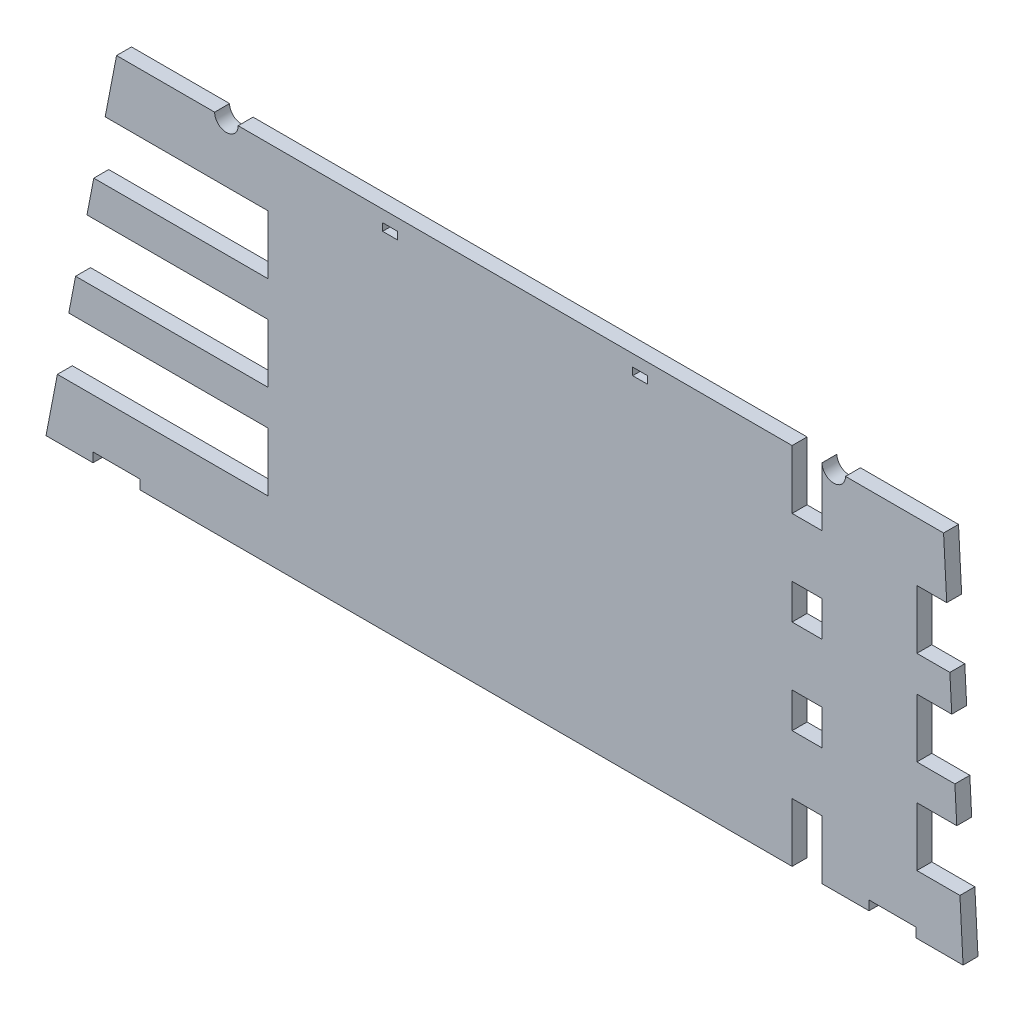
from build123d import *

# Parameters (mm, degrees)
SKETCH1_W      = 12.7
SKETCH1_H      = 15
SKETCH1_W_2    = 6.35
SKETCH1_H_2    = 3.175
EXTRUDE1_DEPTH = 6.35


with BuildPart() as part:
    # Sketch1 → Extrude1 (new body)
    with BuildSketch(Plane.XY):
        with BuildLine():
            Line((-159.50625, 4), (-159.50625, 0))
            Line((-159.50625, 0), (117.79375, 0))
            Line((117.79375, 0), (117.79375, 25))
            Line((117.79375, 25), (130.49375, 25))
            Line((130.49375, 25), (130.49375, 0))
            Line((130.49375, 0), (150.49375, 0))
            Line((150.49375, 0), (150.49375, 4))
            Line((150.49375, 4), (170.49375, 4))
            Line((170.49375, 4), (170.49375, 0))
            Line((170.49375, 0), (190.49375, 0))
            Line((190.49375, 0), (189.157056452, 25))
            Line((189.157056452, 25), (170.842943548, 25))
            Line((170.842943548, 25), (170.842943548, 50))
            Line((170.842943548, 50), (187.820362903, 50))
            Line((187.820362903, 50), (187.018346774, 65))
            Line((187.018346774, 65), (170.842943548, 65))
            Line((170.842943548, 65), (170.842943548, 90))
            Line((170.842943548, 90), (185.681653226, 90))
            Line((185.681653226, 90), (184.879637097, 105))
            Line((184.879637097, 105), (170.842943548, 105))
            Line((170.842943548, 105), (170.842943548, 130))
            Line((170.842943548, 130), (183.542943548, 130))
            Line((183.542943548, 130), (182.20625, 155))
            Line((182.20625, 155), (140.49375, 155))
            ThreePointArc((140.49375, 155), (135.49375, 150), (130.49375, 155))
            Line((130.49375, 155), (130.49375, 130))
            Line((130.49375, 130), (117.79375, 130))
            Line((117.79375, 130), (117.79375, 155))
            Line((117.79375, 155), (-117.79375, 155))
            ThreePointArc((-117.79375, 155), (-122.79375, 150), (-127.79375, 155))
            Line((-127.79375, 155), (-169.50625, 155))
            Line((-169.50625, 155), (-174.344959677, 130))
            Line((-174.344959677, 130), (-105.09375, 130))
            Line((-105.09375, 130), (-105.09375, 105))
            Line((-105.09375, 105), (-179.183669355, 105))
            Line((-179.183669355, 105), (-182.086895161, 90))
            Line((-182.086895161, 90), (-105.09375, 90))
            Line((-105.09375, 90), (-105.09375, 65))
            Line((-105.09375, 65), (-186.925604839, 65))
            Line((-186.925604839, 65), (-189.828830645, 50))
            Line((-189.828830645, 50), (-105.09375, 50))
            Line((-105.09375, 50), (-105.09375, 25))
            Line((-105.09375, 25), (-194.667540323, 25))
            Line((-194.667540323, 25), (-199.50625, 0))
            Line((-199.50625, 0), (-179.50625, 0))
            Line((-179.50625, 0), (-179.50625, 4))
            Line((-179.50625, 4), (-159.50625, 4))
        make_face()
        with Locations((124.14375, 57.5)):
            Rectangle(SKETCH1_W, SKETCH1_H, mode=Mode.SUBTRACT)
        with Locations((-53.175, 148.4125)):
            Rectangle(SKETCH1_W_2, SKETCH1_H_2, mode=Mode.SUBTRACT)
        with Locations((124.14375, 97.5)):
            Rectangle(SKETCH1_W, SKETCH1_H, mode=Mode.SUBTRACT)
        with Locations((53.175, 148.4125)):
            Rectangle(SKETCH1_W_2, SKETCH1_H_2, mode=Mode.SUBTRACT)
    extrude(amount=EXTRUDE1_DEPTH)


solid = part.part
